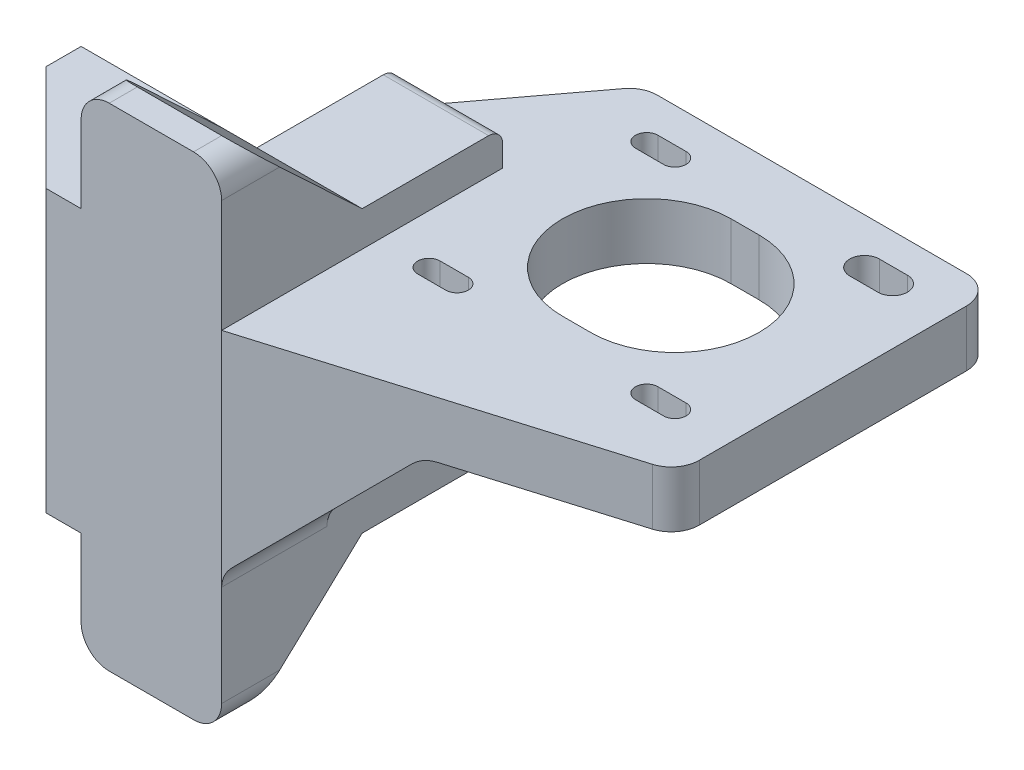
from build123d import *

# Parameters (mm, degrees)
SKETCH1_W                = 40
SKETCH1_H                = 40
BOSS_EXTRUDE1_DEPTH      = 40
SKETCH2_W                = 25
SKETCH2_H                = 20
CUT_EXTRUDE1_DEPTH       = 40
CHAMFER1_SIZE            = 15
CUT_EXTRUDE2_DEPTH       = 15
CHAMFER2_SIZE            = 4
SKETCH4_R                = 2.6
CUT_EXTRUDE3_DEPTH       = 17
BOSS_EXTRUDE3_DEPTH      = 20
FILLET3_R                = 4
BOSS_EXTRUDE2_DEPTH      = 20
BOSS_EXTRUDE2_DEPTH_BACK = 25
SKETCH5_W                = 50
SKETCH5_H                = 8
CUT_EXTRUDE4_DEPTH       = 10
CHAMFER3_SIZE            = 15
CHAMFER3_SIZE_2          = 20
CHAMFER4_SIZE2           = 50
CHAMFER4_SIZE            = 15
FILLET5_START            = 26
FILLET5_DEPTH            = 10
FILLET6_R                = 2
CHAMFER5_START           = -40
CHAMFER5_DEPTH           = 40
CHAMFER5_START_2         = 2
CHAMFER5_2_DEPTH         = 25
SKETCH11_W               = 27.237482008
SKETCH11_H               = 25
CUT_EXTRUDE5_DEPTH       = 25
FILLET7_R                = 4
SKETCH16_W               = 14
SKETCH16_H               = 14
CUT_EXTRUDE6_DEPTH       = 43
CHAMFER6_SIZE            = 10
CHAMFER6_SIZE2           = 2
FILLET9_R                = 2


with BuildPart() as part:
    # Sketch1 → Boss-Extrude1 (new body)
    with BuildSketch(Plane(origin=(0, 0, 0), x_dir=(1, 0, 0), z_dir=(0, 1, 0))):
        with Locations((20, 20)):
            Rectangle(SKETCH1_W, SKETCH1_H)
    extrude(amount=BOSS_EXTRUDE1_DEPTH)

    # Sketch2 → Cut-Extrude1 (cut)
    with BuildSketch(Plane(origin=(0, 40, 0), x_dir=(1, 0, 0), z_dir=(0, 1, 0))):
        with Locations((12.5, 30)):
            Rectangle(SKETCH2_W, SKETCH2_H)
    extrude(amount=-CUT_EXTRUDE1_DEPTH, mode=Mode.SUBTRACT)

    # Chamfer1
    chamfer1_edges = [part.edges().sort_by_distance(p)[0] for p in [
        (0, 20, 0),
    ]]
    chamfer(chamfer1_edges, length=CHAMFER1_SIZE)

    # Sketch3 → Cut-Extrude2 (cut)
    with BuildSketch(Plane.XY):
        Polygon((0, 10), (0, 15), (15, 15), (15, 5), (0, 5), align=None)
        Polygon((0, 30), (0, 25), (15, 25), (15, 35), (0, 35), align=None)
    extrude(amount=-CUT_EXTRUDE2_DEPTH, mode=Mode.SUBTRACT)

    # Chamfer2
    chamfer2_edges = [part.edges().sort_by_distance(p)[0] for p in [
        (15, 35, -7.5),
        (15, 25, -7.5),
        (15, 15, -7.5),
        (15, 5, -7.5),
    ]]
    chamfer(chamfer2_edges, length=CHAMFER2_SIZE)

    # Sketch4 → Cut-Extrude3 (cut)
    with BuildSketch(Plane.XY.offset(-15)):
        with Locations((8, 30)):
            Circle(SKETCH4_R)
        with Locations((8, 10)):
            Circle(SKETCH4_R)
    extrude(amount=-CUT_EXTRUDE3_DEPTH, mode=Mode.SUBTRACT)

    # Sketch9 → Boss-Extrude3 (add)
    with BuildSketch(Plane(origin=(40, 0, 0), x_dir=(0, 0, -1), z_dir=(1, 0, 0))):
        Polygon((0, 40), (0, 55), (4, 55), (20, 40), align=None)
        Polygon((0, 0), (0, -15), (4, -15), (20, 0), align=None)
    extrude(amount=-BOSS_EXTRUDE3_DEPTH)

    # Fillet3
    fillet3_edges = [part.edges().sort_by_distance(p)[0] for p in [
        (20, 55, -2),
        (40, 55, -2),
        (20, -15, -2),
        (40, -15, -2),
    ]]
    fillet(fillet3_edges, radius=FILLET3_R)

    # Sketch5 → Boss-Extrude2 (add, two sides: drawn at the far end of the back side and taken through both)
    with BuildSketch(Plane(origin=(0, 0, -40), x_dir=(-1, 0, 0), z_dir=(0, 0, -1)).offset(-BOSS_EXTRUDE2_DEPTH_BACK)):
        with Locations((-65, 31)):
            Rectangle(SKETCH5_W, SKETCH5_H)
    extrude(amount=BOSS_EXTRUDE2_DEPTH + BOSS_EXTRUDE2_DEPTH_BACK)

    # Sketch10 → Cut-Extrude4 (cut)
    with BuildSketch(Plane(origin=(0, 27, 0), x_dir=(-1, 0, 0), z_dir=(0, -1, 0))):
        with BuildLine():
            ThreePointArc((-47, 51.9), (-45.4, 53.5), (-47, 55.1))
            Line((-47, 55.1), (-51, 55.1))
            ThreePointArc((-51, 55.1), (-52.13137085, 54.63137085), (-52.6, 53.5))
            ThreePointArc((-52.6, 53.5), (-52.13137085, 52.36862915), (-51, 51.9))
            Line((-51, 51.9), (-47, 51.9))
        make_face()
        with BuildLine():
            ThreePointArc((-47, 20.9), (-45.4, 22.5), (-47, 24.1))
            Line((-47, 24.1), (-51, 24.1))
            ThreePointArc((-51, 24.1), (-52.6, 22.5), (-51, 20.9))
            Line((-51, 20.9), (-47, 20.9))
        make_face()
        with BuildLine():
            ThreePointArc((-78, 20.9), (-76.4, 22.5), (-78, 24.1))
            Line((-78, 24.1), (-82, 24.1))
            ThreePointArc((-82, 24.1), (-83.6, 22.5), (-82, 20.9))
            Line((-82, 20.9), (-78, 20.9))
        make_face()
        with BuildLine():
            ThreePointArc((-66.5, 50), (-78.5, 38), (-66.5, 26))
            Line((-66.5, 26), (-62.5, 26))
            ThreePointArc((-62.5, 26), (-50.5, 38), (-62.5, 50))
            Line((-62.5, 50), (-66.5, 50))
        make_face()
        with BuildLine():
            ThreePointArc((-78, 51.4), (-75.9, 53.5), (-78, 55.6))
            Line((-78, 55.6), (-82, 55.6))
            ThreePointArc((-82, 55.6), (-84.1, 53.5), (-82, 51.4))
            Line((-82, 51.4), (-78, 51.4))
        make_face()
    extrude(amount=-CUT_EXTRUDE4_DEPTH, mode=Mode.SUBTRACT)

    # Chamfer3
    # the kernel refuses this chamfer: 20, 15 mm, written as the material it adds along each edge
    with BuildSketch(Plane(origin=(40, 27, -40), x_dir=(-1, 0, 0), z_dir=(0, 1, 0))) as chamfer3_piece_1:
        Polygon((CHAMFER3_SIZE, 0), (0, -CHAMFER3_SIZE_2), (0, 0), align=None)
    extrude(amount=8)

    # Chamfer4
    chamfer4_edges = [part.edges().sort_by_distance(p)[0] for p in [
        (40, 31, -15),
    ]]
    chamfer4_side = [part.faces().sort_by_distance(p)[0] for p in [
        (40, 31, -14.7),
    ]]
    chamfer(chamfer4_edges, length=CHAMFER4_SIZE - 0.0001, length2=CHAMFER4_SIZE2 - 0.0001, reference=chamfer4_side[0])  # a hair under: the kernel refuses the full size

    # Fillet5: read off the stored shape, not the designer's step
    # Fillet5 outline → Fillet5 (cut)
    with BuildSketch(Plane(origin=(0, 0, 0), x_dir=(1, 0, 0), z_dir=(0, 1, 0)).offset(FILLET5_START)):
        with BuildLine():
            Line((90, 15), (90, 17.976122604))
            ThreePointArc((90, 17.976122604), (89.209171713, 15.588400485), (87.149391542, 14.144817463))
            Line((87.149391542, 14.144817463), (90, 15))
        make_face()
        with BuildLine():
            ThreePointArc((38.8, 58.4), (40.211145618, 59.577708764), (42, 60))
            Line((42, 60), (40, 60))
            Line((40, 60), (38.8, 58.4))
        make_face()
        with BuildLine():
            ThreePointArc((86, 60), (88.828427125, 58.828427125), (90, 56))
            Line((90, 56), (90, 60))
            Line((90, 60), (86, 60))
        make_face()
    extrude(amount=FILLET5_DEPTH, mode=Mode.SUBTRACT)

    # Fillet6
    fillet6_edges = [part.edges().sort_by_distance(p)[0] for p in [
        (32.5, 40, -40),
        (32.5, 0, -40),
    ]]
    fillet(fillet6_edges, radius=FILLET6_R)

    # Chamfer5: read off the stored shape, not the designer's step
    # Chamfer5 outline → Chamfer5 (add)
    with BuildSketch(Plane.XY.offset(CHAMFER5_START)):
        Polygon((40, 5), (62, 27), (40, 27), align=None)
    extrude(amount=CHAMFER5_DEPTH)

    # Chamfer5 2 outline → Chamfer5 2 (cut)
    with BuildSketch(Plane(origin=(0, 0, 0), x_dir=(1, 0, 0), z_dir=(0, 1, 0)).offset(CHAMFER5_START_2)):
        with BuildLine():
            Line((51, 24.1), (47, 24.1))
            ThreePointArc((47, 24.1), (45.4, 22.5), (47, 20.9))
            Line((47, 20.9), (51, 20.9))
            ThreePointArc((51, 20.9), (52.6, 22.5), (51, 24.1))
        make_face()
        with BuildLine():
            ThreePointArc((50.667840434, 40), (53.33484861, 30.254033308), (62.5, 26))
            Line((62.5, 26), (64, 26))
            Line((64, 26), (64, 40))
            Line((64, 40), (50.667840434, 40))
        make_face()
        Polygon((64, 0), (64, 7.2), (40, 0), align=None)
    extrude(amount=CHAMFER5_2_DEPTH, mode=Mode.SUBTRACT)

    # Sketch11 → Cut-Extrude5 (cut)
    with BuildSketch(Plane(origin=(0, 0, -40), x_dir=(-1, 0, 0), z_dir=(0, 0, -1))):
        with Locations((-53.618741004, 14.5)):
            Rectangle(SKETCH11_W, SKETCH11_H)
    extrude(amount=-CUT_EXTRUDE5_DEPTH, mode=Mode.SUBTRACT)

    # Fillet7
    fillet7_edges = [part.edges().sort_by_distance(p)[0] for p in [
        (62, 27, -10.8000346),
        (40, 5, -7.5),
    ]]
    fillet(fillet7_edges, radius=FILLET7_R)

    # Sketch16 → Cut-Extrude6 (cut)
    with BuildSketch(Plane.ZY):
        with Locations((-29, 20)):
            Rectangle(SKETCH16_W, SKETCH16_H)
    extrude(amount=-CUT_EXTRUDE6_DEPTH, mode=Mode.SUBTRACT)

    # Chamfer6
    chamfer6_edges = [part.edges().sort_by_distance(p)[0] for p in [
        (40, 20, -36),
    ]]
    chamfer6_side = [part.faces().sort_by_distance(p)[0] for p in [
        (32.5, 20, -36),
    ]]
    chamfer(chamfer6_edges, length=CHAMFER6_SIZE, length2=CHAMFER6_SIZE2, reference=chamfer6_side[0])

    # Fillet9
    fillet9_edges = [part.edges().sort_by_distance(p)[0] for p in [
        (32.5, 13, -22),
        (32.5, 27, -22),
        (27.5, 27, -36),
        (27.5, 13, -36),
        (35, 13, -37),
        (35, 27, -37),
    ]]
    fillet(fillet9_edges, radius=FILLET9_R)


solid = part.part
